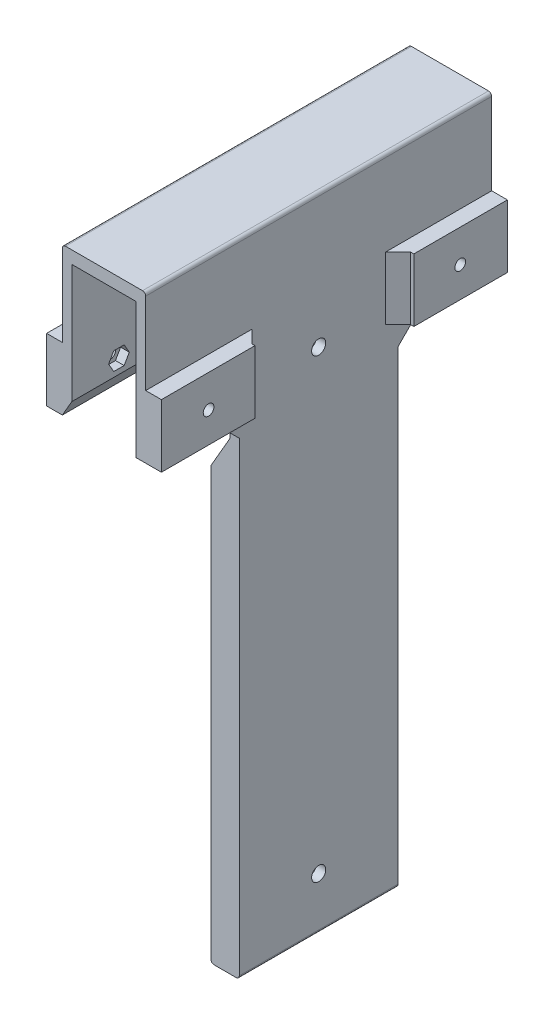
from build123d import *

# Parameters (mm, degrees)
EXTRUDE_1_DEPTH          = 110
SKETCH_3_W               = 5
SKETCH_3_H               = 20
EXTRUDE_2_DEPTH          = 110
CUT_EXTRUDE_1_REACH      = 232.418
SKETCH_2_R               = 2.25
SKETCH_5_W               = 5
SKETCH_5_H               = 50.5
CUT_EXTRUDE_2_DEPTH      = 234.512847612
SKETCH_6_W               = 29.75
SKETCH_6_H               = 157
CUT_EXTRUDE_3_DEPTH      = 10
SKETCH_7_W               = 3
SKETCH_7_H               = 145
EXTRUDE_3_DEPTH          = 6
FILLET_1_R               = 1
CHAMFER_1_SIZE           = 8
CHAMFER_2_SIZE           = 4
SKETCH_8_R               = 1.7
CUT_EXTRUDE_4_DEPTH      = 232.154169333
CUT_EXTRUDE_5_DEPTH      = 13
CUT_EXTRUDE_5_DEPTH_BACK = 13
CHAMFER_3_SIZE           = 12
CHAMFER_3_SIZE_2         = 6.92820323
CHAMFER_4_SIZE           = 5.196152423
CHAMFER_4_SIZE_2         = 3


with BuildPart() as part:
    # 草图1 → 凸台-拉伸1 (new body)
    with BuildSketch(Plane.XY):
        Polygon((0, 0), (20.5, 0), (20.5, -196), (14.5, -196), (14.5, -200), (23.5, -200), (23.5, 4), (-3, 4), (-3, -43), (0, -43), align=None)
    extrude(amount=EXTRUDE_1_DEPTH)

    # 草图3 → 凸台-拉伸2 (add)
    with BuildSketch(Plane(origin=(0, 0, 0), x_dir=(-1, 0, 0), z_dir=(0, 0, -1))):
        with Locations((-26, -33)):
            Rectangle(SKETCH_3_W, SKETCH_3_H)
        with Locations((5.5, -33)):
            Rectangle(SKETCH_3_W, SKETCH_3_H)
    extrude(amount=-EXTRUDE_2_DEPTH)

    # 草图2 → 切除-拉伸1 (cut, up to next)
    with BuildSketch(Plane(origin=(23.5, 0, 0), x_dir=(0, 0, -1), z_dir=(1, 0, 0)), mode=Mode.PRIVATE) as cut_extrude_1_sk1:
        with Locations(Location((-55, -38.5, 0), (0, 0, 90))):
            Circle(SKETCH_2_R)
    cut_extrude_1_tool1 = extrude(cut_extrude_1_sk1.sketch, amount=-CUT_EXTRUDE_1_REACH, mode=Mode.PRIVATE) & part.part
    # 草图2 → 切除-拉伸1 (cut, up to next)
    with BuildSketch(Plane(origin=(23.5, 0, 0), x_dir=(0, 0, -1), z_dir=(1, 0, 0)), mode=Mode.PRIVATE) as cut_extrude_1_sk2:
        with Locations(Location((-55, -183.5, 0), (0, 0, 90))):
            Circle(SKETCH_2_R)
    cut_extrude_1_tool2 = extrude(cut_extrude_1_sk2.sketch, amount=-CUT_EXTRUDE_1_REACH, mode=Mode.PRIVATE) & part.part
    add(cut_extrude_1_tool1.solids().sort_by_distance((23.5, -38.5, 55))[0], mode=Mode.SUBTRACT)
    add(cut_extrude_1_tool2.solids().sort_by_distance((23.5, -183.5, 55))[0], mode=Mode.SUBTRACT)

    # 草图5 → 切除-拉伸2 (cut, through all)
    with BuildSketch(Plane(origin=(0, 4, 0), x_dir=(1, 0, 0), z_dir=(0, 1, 0))):
        with Locations((-5.5, -55)):
            Rectangle(SKETCH_5_W, SKETCH_5_H)
        with Locations((26, -55)):
            Rectangle(SKETCH_5_W, SKETCH_5_H)
    extrude(amount=-CUT_EXTRUDE_2_DEPTH, mode=Mode.SUBTRACT)

    # 草图6 → 切除-拉伸3 (cut)
    with BuildSketch(Plane(origin=(23.5, 0, 0), x_dir=(0, 0, -1), z_dir=(1, 0, 0))):
        with Locations((-95.125, -121.5)):
            Rectangle(SKETCH_6_W, SKETCH_6_H)
        with Locations((-14.875, -121.5)):
            Rectangle(SKETCH_6_W, SKETCH_6_H)
    extrude(amount=-CUT_EXTRUDE_3_DEPTH, mode=Mode.SUBTRACT)

    # 草图7 → 凸台-拉伸3 (add)
    with BuildSketch(Plane.ZY.offset(-20.5)):
        with Locations((31.25, -123.5)):
            Rectangle(SKETCH_7_W, SKETCH_7_H)
        with Locations((78.75, -123.5)):
            Rectangle(SKETCH_7_W, SKETCH_7_H)
    extrude(amount=EXTRUDE_3_DEPTH)

    # 圆角1
    fillet_1_edges = [part.edges().sort_by_distance(p)[0] for p in [
        (23.5, -200, 55),
        (14.5, -200, 55),
        (-3, 4, 55),
        (23.5, 4, 55),
        (14.5, -196, 55),
        (20.5, -196, 55),
        (-3, -43, 55),
    ]]
    fillet(fillet_1_edges, radius=FILLET_1_R)

    # 倒角1
    chamfer_1_edges = [part.edges().sort_by_distance(p)[0] for p in [
        (22, -43, 80.25),
        (22, -43, 29.75),
    ]]
    chamfer(chamfer_1_edges, length=CHAMFER_1_SIZE)

    # 倒角2
    # the kernel refuses this chamfer: 4 mm, written as the material it adds along each edge
    with BuildSketch(Plane(origin=(-3, -23, 29.75), x_dir=(0.027495876610586726, 0, 0.9996219169112968), z_dir=(0, -1, 0))) as chamfer_2_piece_1:
        Polygon((CHAMFER_2_SIZE * 0.999621916911, CHAMFER_2_SIZE * 0.0274958766106), (-CHAMFER_2_SIZE * 0.0274958766106, CHAMFER_2_SIZE * 0.999621916911), (0, 0), align=None)
    extrude(amount=19)
    with BuildSketch(Plane(origin=(-3, -23, 80.25), x_dir=(0.027495876610584242, 0, -0.9996219169112968), z_dir=(0, -1, 0))) as chamfer_2_piece_2:
        Polygon((CHAMFER_2_SIZE * 0.999621916911, -CHAMFER_2_SIZE * 0.0274958766106), (-CHAMFER_2_SIZE * 0.0274958766106, -CHAMFER_2_SIZE * 0.999621916911), (0, 0), align=None)
    extrude(amount=19)
    with BuildSketch(Plane(origin=(-2, -42, 29.75), x_dir=(-0.9999802608561371, 0.0062831439655610674, 0), z_dir=(-0.0062831439655610674, -0.9999802608561371, 0))) as chamfer_2_piece_3_section:
        Polygon((-1 - CHAMFER_2_SIZE, 0), (-1, -CHAMFER_2_SIZE), (-1, 0), align=None)
    chamfer_2_piece_3 = revolve(axis=Axis((-2, -42, 29.75), (0, 0, -1)), revolution_arc=359.64, mode=Mode.PRIVATE)
    chamfer_2_piece_3 = split(chamfer_2_piece_3, bisect_by=Plane(origin=(0, -42.77460492, 31.688294831), z_dir=(-1, 0, 0)), keep=Keep.TOP, mode=Mode.PRIVATE)
    chamfer_2_piece_3 = split(chamfer_2_piece_3, bisect_by=Plane(origin=(-2.77460492, -43, 31.688294831), z_dir=(0, 1, 0)), keep=Keep.TOP, mode=Mode.PRIVATE)
    add(chamfer_2_piece_3)
    with BuildSketch(Plane(origin=(-2, -42, 80.25), x_dir=(-0.9999802608561371, 0.0062831439655610674, 0), z_dir=(-0.0062831439655610674, -0.9999802608561371, 0))) as chamfer_2_piece_4_section:
        Polygon((-1, CHAMFER_2_SIZE), (-1 - CHAMFER_2_SIZE, 0), (-1, 0), align=None)
    chamfer_2_piece_4 = revolve(axis=Axis((-2, -42, 80.25), (0, 0, -1)), revolution_arc=359.64, mode=Mode.PRIVATE)
    chamfer_2_piece_4 = split(chamfer_2_piece_4, bisect_by=Plane(origin=(0, -42.77460492, 78.31170517), z_dir=(-1, 0, 0)), keep=Keep.TOP, mode=Mode.PRIVATE)
    chamfer_2_piece_4 = split(chamfer_2_piece_4, bisect_by=Plane(origin=(-2.77460492, -43, 78.31170517), z_dir=(0, 1, 0)), keep=Keep.TOP, mode=Mode.PRIVATE)
    add(chamfer_2_piece_4)
    with BuildSketch(Plane(origin=(23.5, -23, 80.25), x_dir=(-0.027495876610602904, 0, -0.9996219169112963), z_dir=(0, -1, 0))) as chamfer_2_piece_5:
        Polygon((CHAMFER_2_SIZE * 0.999621916911, CHAMFER_2_SIZE * 0.0274958766106), (-CHAMFER_2_SIZE * 0.0274958766106, CHAMFER_2_SIZE * 0.999621916911), (0, 0), align=None)
    extrude(amount=20)
    with BuildSketch(Plane(origin=(23.5, -23, 29.75), x_dir=(-0.02749587661060549, 0, 0.9996219169112961), z_dir=(0, -1, 0))) as chamfer_2_piece_6:
        Polygon((CHAMFER_2_SIZE * 0.999621916911, -CHAMFER_2_SIZE * 0.0274958766106), (-CHAMFER_2_SIZE * 0.0274958766106, -CHAMFER_2_SIZE * 0.999621916911), (0, 0), align=None)
    extrude(amount=20)

    # 草图8 → 切除-拉伸4 (cut, through all)
    with BuildSketch(Plane.ZY.offset(8)):
        with Locations(Location((15, -33.335006201, 0), (0, 0, 270))):
            Circle(SKETCH_8_R)
        with Locations(Location((95, -33.335006201, 0), (0, 0, 270))):
            Circle(SKETCH_8_R)
    extrude(amount=-CUT_EXTRUDE_4_DEPTH, mode=Mode.SUBTRACT)

    # 草图9 → 切除-拉伸5 (cut, two sides: drawn at the far end of the back side and taken through both)
    with BuildSketch(Plane(origin=(10.25, 0, 0), x_dir=(0, 0, -1), z_dir=(1, 0, 0)).offset(-CUT_EXTRUDE_5_DEPTH_BACK)):
        Polygon((-93.354551733, -30.485006201), (-96.645448267, -30.485006201), (-98.290896534, -33.335006201), (-96.645448267, -36.185006201), (-93.354551733, -36.185006201), (-91.709103466, -33.335006201), align=None)
        Polygon((-13.354551733, -30.485006201), (-16.645448267, -30.485006201), (-18.290896534, -33.335006201), (-16.645448267, -36.185006201), (-13.354551733, -36.185006201), (-11.709103466, -33.335006201), align=None)
    extrude(amount=CUT_EXTRUDE_5_DEPTH + CUT_EXTRUDE_5_DEPTH_BACK, mode=Mode.SUBTRACT)

    # 倒角3
    # the kernel refuses this chamfer: 12, 6.92820323 mm, written as the material it takes off along each edge
    with BuildSketch(Plane(origin=(14.5, -51, 111.295029056), x_dir=(-0.019326765612700716, -0.9998132206222078, -4.736066806866801e-15), z_dir=(0, 0, -1))) as chamfer_3_piece_1_section:
        Polygon((CHAMFER_3_SIZE * 0.999813220622, -CHAMFER_3_SIZE * 0.0193267656127), (-CHAMFER_3_SIZE_2 * 0.0193267656135, -CHAMFER_3_SIZE_2 * 0.999813220662), (0, 0), align=None)
    chamfer_3_piece_1 = extrude(amount=65.090058112, mode=Mode.PRIVATE)
    chamfer_3_piece_1 = split(chamfer_3_piece_1, bisect_by=Plane(origin=(20.5, -55.138426071, 78.75), z_dir=(-1, 0, 0)), keep=Keep.TOP, mode=Mode.PRIVATE)
    add(chamfer_3_piece_1, mode=Mode.SUBTRACT)
    with BuildSketch(Plane(origin=(14.5, -51, 63.795029056), x_dir=(0.9983227437537925, 0.0578938624026711, 0), z_dir=(0, 0, -1))) as chamfer_3_piece_2_section:
        Polygon((CHAMFER_3_SIZE_2 * 0.998322743793, CHAMFER_3_SIZE_2 * 0.057893862405), (-CHAMFER_3_SIZE * 0.0578938624027, CHAMFER_3_SIZE * 0.998322743754), (0, 0), align=None)
    chamfer_3_piece_2 = extrude(amount=65.090058112, mode=Mode.PRIVATE)
    chamfer_3_piece_2 = split(chamfer_3_piece_2, bisect_by=Plane(origin=(20.5, -55.138426071, 31.25), z_dir=(-1, 0, 0)), keep=Keep.TOP, mode=Mode.PRIVATE)
    add(chamfer_3_piece_2, mode=Mode.SUBTRACT)

    # 倒角4
    # the kernel refuses this chamfer: 5.196152423, 3 mm, written as the material it takes off along each edge
    with BuildSketch(Plane(origin=(0, -43, 123.442891912), x_dir=(0.01932676561270063, 0.9998132206222079, 0), z_dir=(0, 0, -1))) as chamfer_4_piece_1:
        Polygon((CHAMFER_4_SIZE * 0.999813220566, -CHAMFER_4_SIZE * 0.0193267656116), (-CHAMFER_4_SIZE_2 * 0.0193267656127, -CHAMFER_4_SIZE_2 * 0.999813220622), (0, 0), align=None)
    extrude(amount=136.885783824, mode=Mode.SUBTRACT)


solid = part.part
